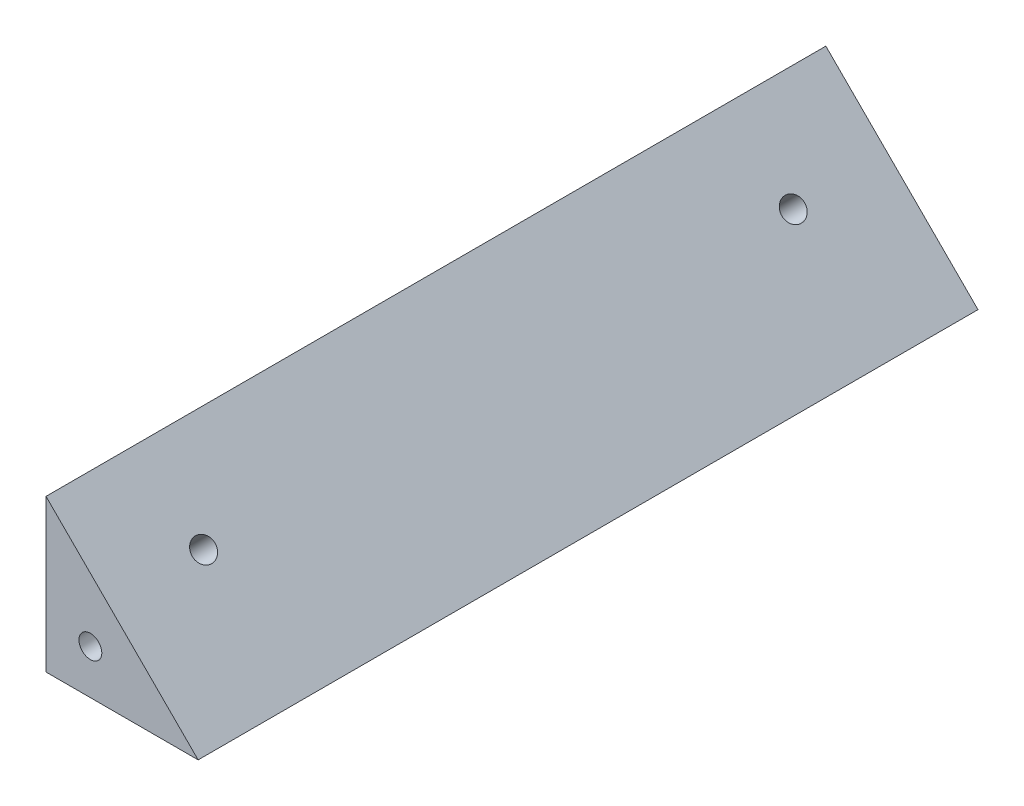
from build123d import *

# Parameters (mm, degrees)
BOSS_EXTRUDE1_DEPTH = 61.5
SKETCH1_5_R         = 0.9
BOSS_EXTRUDE2_DEPTH = 1.2
SKETCH2_4_R         = 0.9
BOSS_EXTRUDE3_DEPTH = 1.2
SKETCH4_3_R         = 0.9
BOSS_EXTRUDE4_DEPTH = 1.2
CUT_EXTRUDE4_DEPTH  = 64.798510954
SKETCH1_9_R         = 0.9
CUT_EXTRUDE6_DEPTH  = 3
CUT_EXTRUDE7_START  = -3
SKETCH2_5_R         = 0.9
CUT_EXTRUDE7_DEPTH  = 3
SKETCH4_4_R         = 0.9
CUT_EXTRUDE8_DEPTH  = 3


with BuildPart() as part:
    # Sketch1 → Boss-Extrude1 (new body)
    with BuildSketch(Plane.XY):
        Polygon((12, 0), (0, 12), (0, 0), align=None)
    extrude(amount=BOSS_EXTRUDE1_DEPTH)

    # Sketch1<5> → Boss-Extrude2 (add)
    with BuildSketch(Plane.XY):
        Polygon((10.535533906, 0), (4.247146227, 6.288387679), (1.458758548, 5.541241452), (0.711612321, 2.752853773), (3.464466094, 0), align=None)
        with Locations((3.5, 3.5)):
            Circle(SKETCH1_5_R, mode=Mode.SUBTRACT)
    extrude(amount=BOSS_EXTRUDE2_DEPTH)

    # Sketch2<4> → Boss-Extrude3 (add)
    with BuildSketch(Plane.XY.offset(61.5)):
        Polygon((0.711612321, 2.752853773), (3.464466094, 0), (10.535533906, 0), (4.247146227, 6.288387679), (1.458758548, 5.541241452), align=None)
        with Locations((3.5, 3.5)):
            Circle(SKETCH2_4_R, mode=Mode.SUBTRACT)
    extrude(amount=-BOSS_EXTRUDE3_DEPTH)

    # Sketch4<3> → Boss-Extrude4 (add)
    # profile 1 of 2: a face of its own
    with BuildSketch(Plane(origin=(6, 6, 0), x_dir=(0, 0, -1), z_dir=(0.7071067811865477, 0.7071067811865475, 0))):
        Polygon((-51.5, -8.485281374), (-51.5, 2.958094299), (-54, 4.401469972), (-56.5, 2.958094299), (-56.5, -8.485281374), align=None)
        with Locations((-54, 1.514718626)):
            Circle(SKETCH4_3_R, mode=Mode.SUBTRACT)
    # profile 2 of 2: a face of its own
    with BuildSketch(Plane(origin=(6, 6, 0), x_dir=(0, 0, -1), z_dir=(0.7071067811865477, 0.7071067811865475, 0))):
        Polygon((-5, -8.485281374), (-5, 2.958094299), (-7.5, 4.401469972), (-10, 2.958094299), (-10, -8.485281374), align=None)
        with Locations((-7.5, 1.514718626)):
            Circle(SKETCH4_3_R, mode=Mode.SUBTRACT)
    extrude(amount=-BOSS_EXTRUDE4_DEPTH)

    # Sketch1<6> → Cut-Extrude4 (cut, through all)
    with BuildSketch(Plane.XY):
        Polygon((12, -2.237434652), (12, 0), (10.535533906, 0), (7, 0), (3.5, 0), (3.464466094, 0), (0, 0), (0, -2.237434652), align=None)
    extrude(amount=CUT_EXTRUDE4_DEPTH, mode=Mode.SUBTRACT)

    # Sketch1<9> → Cut-Extrude6 (cut)
    with BuildSketch(Plane.XY):
        with Locations((3.5, 3.5)):
            Circle(SKETCH1_9_R)
    extrude(amount=CUT_EXTRUDE6_DEPTH, mode=Mode.SUBTRACT)

    # Sketch2<5> → Cut-Extrude7 (cut)
    with BuildSketch(Plane.XY.offset(61.5).offset(CUT_EXTRUDE7_START)):
        with Locations((3.5, 3.5)):
            Circle(SKETCH2_5_R)
    extrude(amount=CUT_EXTRUDE7_DEPTH, mode=Mode.SUBTRACT)

    # Sketch4<4> → Cut-Extrude8 (cut)
    with BuildSketch(Plane(origin=(6, 6, 0), x_dir=(0, 0, -1), z_dir=(0.7071067811865477, 0.7071067811865475, 0))):
        with Locations((-7.5, 1.514718626)):
            Circle(SKETCH4_4_R)
        with Locations((-54, 1.514718626)):
            Circle(SKETCH4_4_R)
    extrude(amount=-CUT_EXTRUDE8_DEPTH, mode=Mode.SUBTRACT)


solid = part.part
